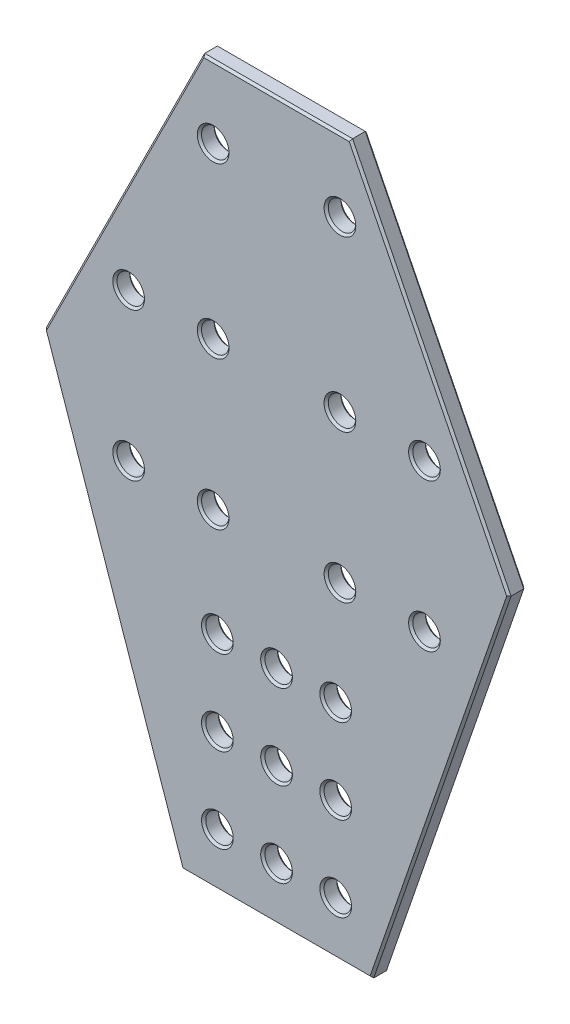
from build123d import *

# Parameters (mm, degrees)
SKETCH_1_R        = 13
EXTRUDE_874_DEPTH = 16
CHAMFER_1_SIZE    = 2


with BuildPart() as part:
    # 草图1 → Extrude 874 (new body)
    with BuildSketch(Plane.XY):
        Polygon((-70, 228), (70, 228), (220, -72), (90, -450), (-90, -450), (-220, -72), align=None)
        with Locations((-140, 0)):
            Circle(SKETCH_1_R, mode=Mode.SUBTRACT)
        with Locations((-60, 0)):
            Circle(SKETCH_1_R, mode=Mode.SUBTRACT)
        with Locations((60, -140)):
            Circle(SKETCH_1_R, mode=Mode.SUBTRACT)
        with Locations((140, -140)):
            Circle(SKETCH_1_R, mode=Mode.SUBTRACT)
        with Locations((-140, -140)):
            Circle(SKETCH_1_R, mode=Mode.SUBTRACT)
        with Locations((-60, -140)):
            Circle(SKETCH_1_R, mode=Mode.SUBTRACT)
        with Locations((60, 0)):
            Circle(SKETCH_1_R, mode=Mode.SUBTRACT)
        with Locations((140, 0)):
            Circle(SKETCH_1_R, mode=Mode.SUBTRACT)
        with Locations((0, -400)):
            Circle(SKETCH_1_R, mode=Mode.SUBTRACT)
        with Locations((0, -240)):
            Circle(SKETCH_1_R, mode=Mode.SUBTRACT)
        with Locations((60, 160)):
            Circle(SKETCH_1_R, mode=Mode.SUBTRACT)
        with Locations((0, -320)):
            Circle(SKETCH_1_R, mode=Mode.SUBTRACT)
        with Locations((-60, 160)):
            Circle(SKETCH_1_R, mode=Mode.SUBTRACT)
        with Locations((56, -240)):
            Circle(SKETCH_1_R, mode=Mode.SUBTRACT)
        with Locations((56, -320)):
            Circle(SKETCH_1_R, mode=Mode.SUBTRACT)
        with Locations((56, -400)):
            Circle(SKETCH_1_R, mode=Mode.SUBTRACT)
        with Locations((-56, -400)):
            Circle(SKETCH_1_R, mode=Mode.SUBTRACT)
        with Locations((-56, -320)):
            Circle(SKETCH_1_R, mode=Mode.SUBTRACT)
        with Locations((-56, -240)):
            Circle(SKETCH_1_R, mode=Mode.SUBTRACT)
    extrude(amount=EXTRUDE_874_DEPTH)

    # 倒角1
    chamfer_1_edges = [part.edges().sort_by_distance(p)[0] for p in [
        (-69, -240, 0),
        (-69, -400, 0),
        (43, -320, 0),
        (-73, 160, 0),
        (-13, -320, 0),
        (-13, -400, 0),
        (47, 0, 0),
        (-153, -140, 0),
        (47, -140, 0),
        (-153, 0, 0),
        (-155, -261, 0),
        (0, -450, 0),
        (155, -261, 0),
        (145, 78, 0),
        (0, 228, 0),
        (-145, 78, 0),
        (-73, 0, 0),
        (127, -140, 0),
        (-73, -140, 0),
        (127, 0, 0),
        (-13, -240, 0),
        (47, 160, 0),
        (43, -240, 0),
        (43, -400, 0),
        (-69, -320, 0),
        (-69, -240, 16),
        (-69, -400, 16),
        (43, -320, 16),
        (-73, 160, 16),
        (-13, -320, 16),
        (-13, -400, 16),
        (47, 0, 16),
        (-153, -140, 16),
        (47, -140, 16),
        (-153, 0, 16),
        (0, 228, 16),
        (145, 78, 16),
        (155, -261, 16),
        (0, -450, 16),
        (-155, -261, 16),
        (-145, 78, 16),
        (-73, 0, 16),
        (127, -140, 16),
        (-73, -140, 16),
        (127, 0, 16),
        (-13, -240, 16),
        (47, 160, 16),
        (43, -240, 16),
        (43, -400, 16),
        (-69, -320, 16),
    ]]
    chamfer(chamfer_1_edges, length=CHAMFER_1_SIZE)


solid = part.part
